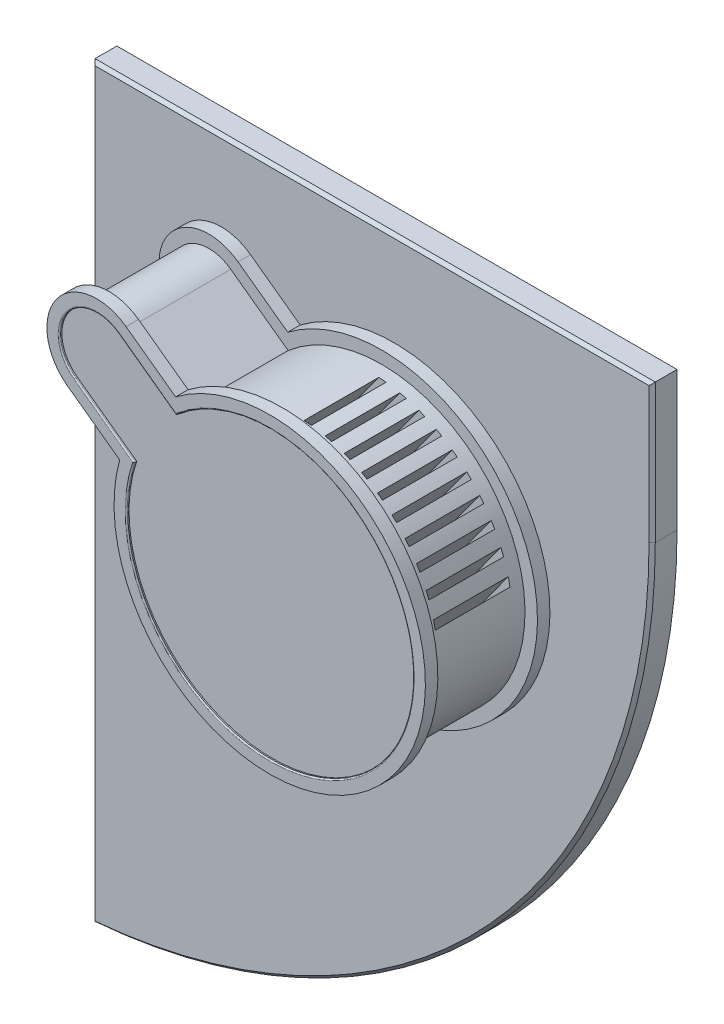
from build123d import *

# Parameters (mm, degrees)
BOSS_EXTRUDE1_DEPTH         = 2
BOSS_EXTRUDE2_DEPTH         = 1
CHAMFER1_SIZE               = 0.25
BOSS_EXTRUDE3_DEPTH         = 8
CUT_EXTRUDE_THIN1_START     = -11.887644895
CUT_EXTRUDE_THIN1_OUTLINE_W = 0.5
CUT_EXTRUDE_THIN1_OUTLINE_H = 6
CUT_EXTRUDE_THIN1_DEPTH     = 23
CUT_EXTRUDE1_START          = -0.2
CUT_EXTRUDE1_DEPTH          = 0.2
FILLET1_R                   = 0.1


# Read off the part's stored shape, not the designer's step: Cut-Extrude-Thin1
with BuildPart() as part:
    # Sketch1 → Boss-Extrude1 (new body)
    with BuildSketch(Plane.XY):
        with BuildLine():
            Line((0.767949192, 12), (0.767949192, -48))
            ThreePointArc((0.767949192, -48), (32.790806806, -32.362304412), (45.75, 0.834988321))
            Line((45.75, 0.834988321), (45.75, 12))
            Line((45.75, 12), (0.767949192, 12))
        make_face()
    extrude(amount=BOSS_EXTRUDE1_DEPTH)

    # Sketch2 → Boss-Extrude2 (add)
    with BuildSketch(Plane.XY.offset(2)):
        with BuildLine():
            Line((8.80088089, -1.616278944), (12.994920502, -4.6656628))
            ThreePointArc((12.994920502, -4.6656628), (35.387361749, -15.015949775), (17.487536068, 1.958917118))
            Line((17.487536068, 1.958917118), (13.505420168, 4.854216415))
            ThreePointArc((13.505420168, 4.854216415), (7.91790285, 3.971238374), (8.80088089, -1.616278944))
        make_face()
    boss_extrude2 = extrude(amount=BOSS_EXTRUDE2_DEPTH)

    # Chamfer1
    chamfer1_edges = [part.edges().sort_by_distance(p)[0] for p in [
        (32.790806806, -32.362304412, 2),
        (45.75, 6.41749416, 2),
        (23.258974596, 12, 2),
        (0.767949192, -18, 2),
    ]]
    chamfer(chamfer1_edges, length=CHAMFER1_SIZE)

    # Sketch4 → Boss-Extrude3 (add)
    with BuildSketch(Plane.XY.offset(3)):
        with BuildLine():
            Line((17.520070281, 0.698880903), (12.917352758, 4.045404495))
            ThreePointArc((12.917352758, 4.045404495), (8.726714769, 3.383170965), (9.3889483, -0.807467024))
            Line((9.3889483, -0.807467024), (14.161225934, -4.277273635))
            ThreePointArc((14.161225934, -4.277273635), (34.573815964, -14.433858921), (17.520070281, 0.698880903))
        make_face()
    extrude(amount=BOSS_EXTRUDE3_DEPTH)

    # Mirror1: Boss-Extrude2 across plane
    add(boss_extrude2.mirror(Plane.XY.offset(7)))

    # Cut-Extrude-Thin1 outline → Cut-Extrude-Thin1 (cut)
    with BuildSketch(Plane(origin=(4.627058781, 6.363930791, 0), x_dir=(-0.8088119198432459, 0.5880674096729752, 0), z_dir=(-0.5880674096729752, -0.8088119198432459, 0)).offset(CUT_EXTRUDE_THIN1_START)):
        with Locations((-32.575215368, -7)):
            Rectangle(CUT_EXTRUDE_THIN1_OUTLINE_W, CUT_EXTRUDE_THIN1_OUTLINE_H)
        with Locations((-29.575215368, -7)):
            Rectangle(CUT_EXTRUDE_THIN1_OUTLINE_W, CUT_EXTRUDE_THIN1_OUTLINE_H)
        with Locations((-26.575215368, -7)):
            Rectangle(CUT_EXTRUDE_THIN1_OUTLINE_W, CUT_EXTRUDE_THIN1_OUTLINE_H)
        with Locations((-23.575215368, -7)):
            Rectangle(CUT_EXTRUDE_THIN1_OUTLINE_W, CUT_EXTRUDE_THIN1_OUTLINE_H)
        with Locations((-31.075215368, -7)):
            Rectangle(CUT_EXTRUDE_THIN1_OUTLINE_W, CUT_EXTRUDE_THIN1_OUTLINE_H)
        with Locations((-28.075215368, -7)):
            Rectangle(CUT_EXTRUDE_THIN1_OUTLINE_W, CUT_EXTRUDE_THIN1_OUTLINE_H)
        with Locations((-25.075215368, -7)):
            Rectangle(CUT_EXTRUDE_THIN1_OUTLINE_W, CUT_EXTRUDE_THIN1_OUTLINE_H)
        with Locations((-22.075215368, -7)):
            Rectangle(CUT_EXTRUDE_THIN1_OUTLINE_W, CUT_EXTRUDE_THIN1_OUTLINE_H)
        with Locations((-20.575215368, -7)):
            Rectangle(CUT_EXTRUDE_THIN1_OUTLINE_W, CUT_EXTRUDE_THIN1_OUTLINE_H)
        with Locations((-19.075215368, -7)):
            Rectangle(CUT_EXTRUDE_THIN1_OUTLINE_W, CUT_EXTRUDE_THIN1_OUTLINE_H)
    extrude(amount=CUT_EXTRUDE_THIN1_DEPTH, mode=Mode.SUBTRACT)

    # Sketch9 → Cut-Extrude1 (cut)
    with BuildSketch(Plane.XY.offset(12).offset(CUT_EXTRUDE1_START)):
        with BuildLine():
            Line((17.520070281, 0.698880903), (12.917352758, 4.045404495))
            ThreePointArc((12.917352758, 4.045404495), (8.726714769, 3.383170965), (9.3889483, -0.807467024))
            Line((9.3889483, -0.807467024), (14.161225934, -4.277273635))
            ThreePointArc((14.161225934, -4.277273635), (34.573815964, -14.433858921), (17.520070281, 0.698880903))
        make_face()
    extrude(amount=CUT_EXTRUDE1_DEPTH, mode=Mode.SUBTRACT)

    # Fillet1
    fillet1_edges = [part.edges().sort_by_distance(p)[0] for p in [
        (8.726714769, 3.383170965, 12),
        (11.775087117, -2.542370329, 12),
        (34.573815964, -14.433858921, 12),
        (15.21871152, 2.372142699, 12),
    ]]
    fillet(fillet1_edges, radius=FILLET1_R)


solid = part.part
